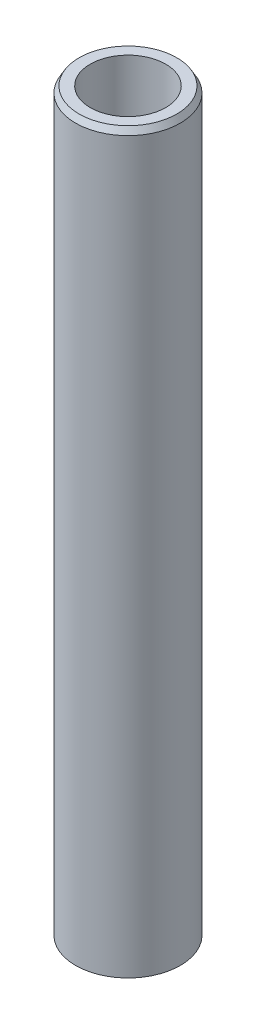
from build123d import *
from OCP.BRepFilletAPI import BRepFilletAPI_MakeChamfer

# Parameters (mm, degrees)
SKETCH1_R           = 42.5
BOSS_EXTRUDE1_DEPTH = 600
SKETCH2_R           = 30.605687074
CUT_EXTRUDE1_DEPTH  = 604.002902149
CHAMFER1_SIZE       = 4.961900876
CHAMFER1_SIZE2      = 2.864754806


with BuildPart() as part:
    # Sketch1 → Boss-Extrude1 (new body)
    with BuildSketch(Plane(origin=(0, 0, 0), x_dir=(1, 0, 0), z_dir=(0, 1, 0))):
        Circle(SKETCH1_R)
    extrude(amount=BOSS_EXTRUDE1_DEPTH)

    # Sketch2 → Cut-Extrude1 (cut, through all)
    with BuildSketch(Plane(origin=(0, 0, 0), x_dir=(1, 0, 0), z_dir=(0, 1, 0))):
        Circle(SKETCH2_R)
    extrude(amount=CUT_EXTRUDE1_DEPTH, mode=Mode.SUBTRACT)

    # Chamfer1: one chamfer whose edges measure the first distance from different faces: ONE call of the kernel's chamfer builder (chamfer() names one face for all edges)
    chamfer1_edges_1 = [part.edges().sort_by_distance(p)[0] for p in [
        (-42.5, 600, 0),
    ]]
    chamfer1_side_1 = [part.faces().sort_by_distance(p)[0] for p in [
        (-42.5, 300, 0),
    ]]
    chamfer1_edges_2 = [part.edges().sort_by_distance(p)[0] for p in [
        (-42.5, 0, 0),
    ]]
    chamfer1_side_2 = [part.faces().sort_by_distance(p)[0] for p in [
        (-41.297918472, 0, 0),
    ]]
    chamfer1 = BRepFilletAPI_MakeChamfer(part.part.solid().wrapped)
    for e in chamfer1_edges_1:
        chamfer1.Add(CHAMFER1_SIZE, CHAMFER1_SIZE2, e.wrapped, chamfer1_side_1[0].wrapped)  # the first distance lies on this face
    for e in chamfer1_edges_2:
        chamfer1.Add(CHAMFER1_SIZE, CHAMFER1_SIZE2, e.wrapped, chamfer1_side_2[0].wrapped)  # the first distance lies on this face
    add(Compound.cast(chamfer1.Shape()), mode=Mode.REPLACE)


solid = part.part
